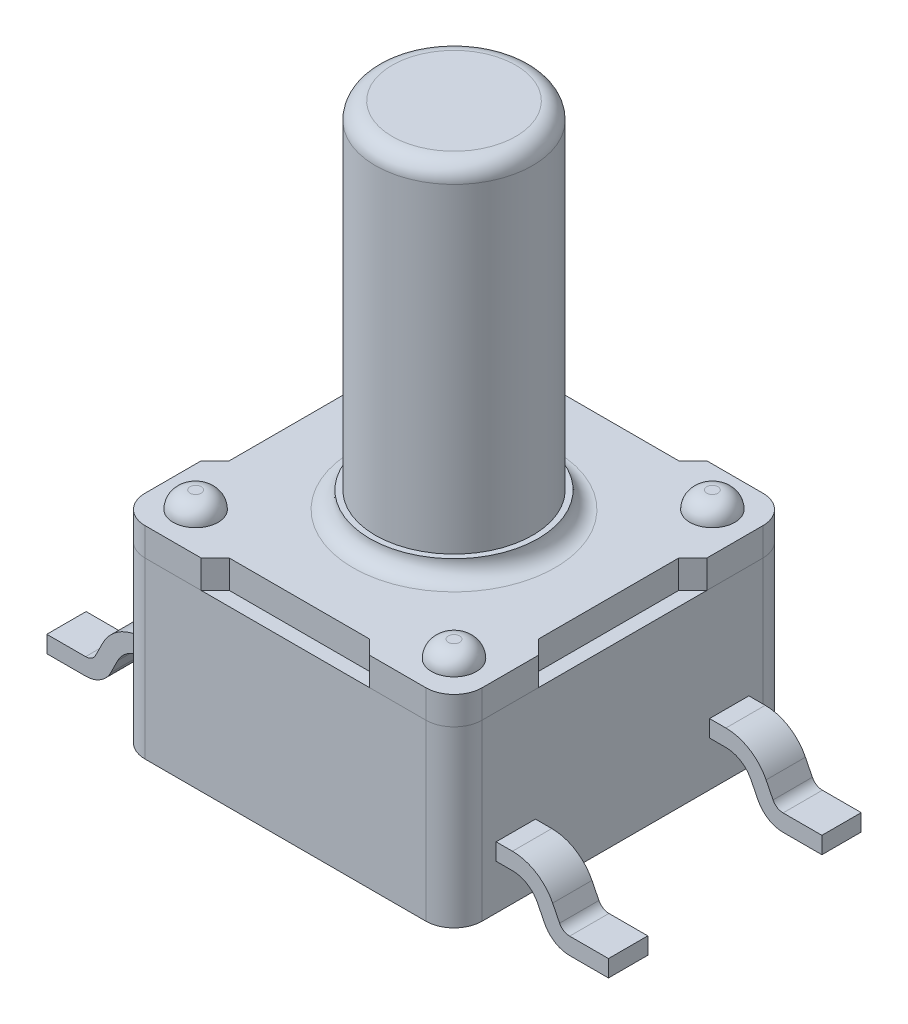
from build123d import *

# Parameters (mm, degrees)
BOSS_EXTRUDE1_DEPTH   = 3.1
BOSS_EXTRUDE2_DEPTH   = 0.5
SKETCH3_R             = 0.4
BOSS_EXTRUDE3_DEPTH   = 0.3
BOSS_EXTRUDE3_2_DEPTH = 0.3
BOSS_EXTRUDE3_3_DEPTH = 0.3
BOSS_EXTRUDE3_4_DEPTH = 0.3
FILLET1_R             = 0.3
FILLET2_R             = 0.3
FILLET3_R             = 0.3
FILLET4_R             = 0.3
SKETCH4_R             = 1.5
BOSS_EXTRUDE4_DEPTH   = 0.3
BOSS_EXTRUDE6_START   = 2.25
BOSS_EXTRUDE6_DEPTH   = 0.7
LPATTERN1_COUNT       = 2
LPATTERN1_PITCH       = 3.8
MIRROR5_START         = 2.25
MIRROR5_COPY_1_DEPTH  = 0.7
CUT_EXTRUDE1_DEPTH    = 0.5
FILLET8_R             = 0.3
SKETCH10_R            = 1.4
BOSS_EXTRUDE10_DEPTH  = 6
FILLET9_R             = 0.3


# Some blends are built 0.0001 mm under size
with BuildPart() as part:
    # Sketch1 → Boss-Extrude1 (new body)
    with BuildSketch(Plane(origin=(0, 0, 0), x_dir=(1, 0, 0), z_dir=(0, 1, 0))):
        with BuildLine():
            Line((-2.5, -3), (2.5, -3))
            ThreePointArc((2.5, -3), (2.853553391, -2.853553391), (3, -2.5))
            Line((3, -2.5), (3, 2.5))
            ThreePointArc((3, 2.5), (2.853553391, 2.853553391), (2.5, 3))
            Line((2.5, 3), (-2.5, 3))
            ThreePointArc((-2.5, 3), (-2.853553391, 2.853553391), (-3, 2.5))
            Line((-3, 2.5), (-3, -2.5))
            ThreePointArc((-3, -2.5), (-2.853553391, -2.853553391), (-2.5, -3))
        make_face()
    extrude(amount=BOSS_EXTRUDE1_DEPTH)


with BuildPart() as body_2:
    # Sketch2 → Boss-Extrude2 (new body)
    with BuildSketch(Plane(origin=(0, 3.1, 0), x_dir=(1, 0, 0), z_dir=(0, 1, 0))):
        with BuildLine():
            Line((-2.5, -3), (2.5, -3))
            ThreePointArc((2.5, -3), (2.853553391, -2.853553391), (3, -2.5))
            Line((3, -2.5), (3, 2.5))
            ThreePointArc((3, 2.5), (2.853553391, 2.853553391), (2.5, 3))
            Line((2.5, 3), (-2.5, 3))
            ThreePointArc((-2.5, 3), (-2.853553391, 2.853553391), (-3, 2.5))
            Line((-3, 2.5), (-3, -2.5))
            ThreePointArc((-3, -2.5), (-2.853553391, -2.853553391), (-2.5, -3))
        make_face()
    extrude(amount=BOSS_EXTRUDE2_DEPTH)

    # Sketch4 → Boss-Extrude4 (add)
    with BuildSketch(Plane(origin=(0, 3.6, 0), x_dir=(1, 0, 0), z_dir=(0, 1, 0))):
        with Locations(Location((0, 0, 0), (0, 0, 270))):
            Circle(SKETCH4_R)
    extrude(amount=BOSS_EXTRUDE4_DEPTH)

    # Sketch7 → Cut-Extrude1 (cut)
    with BuildSketch(Plane(origin=(0, 3.6, 0), x_dir=(1, 0, 0), z_dir=(0, 1, 0))):
        Polygon((-1.5, 3), (-1.25, 2.75), (1.25, 2.75), (1.5, 3), align=None)
        Polygon((3, -1.5), (3, 1.5), (2.75, 1.25), (2.75, -1.25), align=None)
        Polygon((-1.5, -3), (1.5, -3), (1.25, -2.75), (-1.25, -2.75), align=None)
        Polygon((-3, 1.5), (-3, -1.5), (-2.75, -1.25), (-2.75, 1.25), align=None)
    extrude(amount=-CUT_EXTRUDE1_DEPTH, mode=Mode.SUBTRACT)

    # Fillet8
    fillet8_edges = [body_2.edges().sort_by_distance(p)[0] for p in [
        (0, 3.6, -1.5),
    ]]
    fillet(fillet8_edges, radius=FILLET8_R - 0.0001)  # a hair under: the kernel refuses the full size


with BuildPart() as body_3:
    # Sketch3 → Boss-Extrude3 (new body)
    with BuildSketch(Plane(origin=(0, 3.6, 0), x_dir=(1, 0, 0), z_dir=(0, 1, 0))):
        with Locations(Location((-2.3, 2.3, 0), (0, 0, 270))):
            Circle(SKETCH3_R)
    extrude(amount=BOSS_EXTRUDE3_DEPTH)

    # Fillet2
    # the kernel refuses this fillet: 0.3 mm, written as the material it takes off along each edge
    with BuildSketch(Plane(origin=(-2.3, 3.9, -2.3), x_dir=(0, 0, 1), z_dir=(-1, 0, 0))) as fillet2_piece_1:
        with BuildLine():
            CenterArc((0.4 - FILLET2_R, -FILLET2_R), FILLET2_R, 0, 90)
            Line((0.4 - FILLET2_R, 0), (0.4, 0))
            Line((0.4, 0), (0.4, -FILLET2_R))
        make_face()
    revolve(axis=Axis((-2.3, 3.9, -2.3), (0, 1, 0)), mode=Mode.SUBTRACT)


with BuildPart() as body_4:
    # Sketch3 → Boss-Extrude3 2 (new body)
    with BuildSketch(Plane(origin=(0, 3.6, 0), x_dir=(1, 0, 0), z_dir=(0, 1, 0))):
        with Locations(Location((2.3, 2.3, 0), (0, 0, 270))):
            Circle(SKETCH3_R)
    extrude(amount=BOSS_EXTRUDE3_2_DEPTH)

    # Fillet3
    # the kernel refuses this fillet: 0.3 mm, written as the material it takes off along each edge
    with BuildSketch(Plane(origin=(2.3, 3.9, -2.3), x_dir=(0, 0, 1), z_dir=(-1, 0, 0))) as fillet3_piece_1:
        with BuildLine():
            CenterArc((0.4 - FILLET3_R, -FILLET3_R), FILLET3_R, 0, 90)
            Line((0.4 - FILLET3_R, 0), (0.4, 0))
            Line((0.4, 0), (0.4, -FILLET3_R))
        make_face()
    revolve(axis=Axis((2.3, 3.9, -2.3), (0, 1, 0)), mode=Mode.SUBTRACT)


with BuildPart() as body_5:
    # Sketch3 → Boss-Extrude3 3 (new body)
    with BuildSketch(Plane(origin=(0, 3.6, 0), x_dir=(1, 0, 0), z_dir=(0, 1, 0))):
        with Locations(Location((2.3, -2.3, 0), (0, 0, 270))):
            Circle(SKETCH3_R)
    extrude(amount=BOSS_EXTRUDE3_3_DEPTH)

    # Fillet4
    # the kernel refuses this fillet: 0.3 mm, written as the material it takes off along each edge
    with BuildSketch(Plane(origin=(2.3, 3.9, 2.3), x_dir=(0, 0, 1), z_dir=(-1, 0, 0))) as fillet4_piece_1:
        with BuildLine():
            CenterArc((0.4 - FILLET4_R, -FILLET4_R), FILLET4_R, 0, 90)
            Line((0.4 - FILLET4_R, 0), (0.4, 0))
            Line((0.4, 0), (0.4, -FILLET4_R))
        make_face()
    revolve(axis=Axis((2.3, 3.9, 2.3), (0, 1, 0)), mode=Mode.SUBTRACT)


with BuildPart() as body_6:
    # Sketch3 → Boss-Extrude3 4 (new body)
    with BuildSketch(Plane(origin=(0, 3.6, 0), x_dir=(1, 0, 0), z_dir=(0, 1, 0))):
        with Locations(Location((-2.3, -2.3, 0), (0, 0, 270))):
            Circle(SKETCH3_R)
    extrude(amount=BOSS_EXTRUDE3_4_DEPTH)

    # Fillet1
    # the kernel refuses this fillet: 0.3 mm, written as the material it takes off along each edge
    with BuildSketch(Plane(origin=(-2.3, 3.9, 2.3), x_dir=(0, 0, 1), z_dir=(-1, 0, 0))) as fillet1_piece_1:
        with BuildLine():
            CenterArc((0.4 - FILLET1_R, -FILLET1_R), FILLET1_R, 0, 90)
            Line((0.4 - FILLET1_R, 0), (0.4, 0))
            Line((0.4, 0), (0.4, -FILLET1_R))
        make_face()
    revolve(axis=Axis((-2.3, 3.9, 2.3), (0, 1, 0)), mode=Mode.SUBTRACT)


with BuildPart() as body_7:
    # Sketch6 → Boss-Extrude6 (new body)
    with BuildSketch(Plane.XY.offset(BOSS_EXTRUDE6_START)):
        with BuildLine():
            Line((3, 0.8), (3.290983006, 0.8))
            ThreePointArc((3.290983006, 0.8), (3.553848562, 0.725325404), (3.738196601, 0.523606798))
            Line((3.738196601, 0.523606798), (3.861803399, 0.276393202))
            ThreePointArc((3.861803399, 0.276393202), (4.046151438, 0.074674596), (4.309016994, 0))
            Line((4.309016994, 0), (5, 0))
            Line((5, 0), (5, 0.3))
            Line((5, 0.3), (4.309016994, 0.3))
            ThreePointArc((4.309016994, 0.3), (4.203870772, 0.329869838), (4.130131556, 0.410557281))
            Line((4.130131556, 0.410557281), (4.006524758, 0.657770876))
            ThreePointArc((4.006524758, 0.657770876), (3.711567895, 0.980520647), (3.290983006, 1.1))
            Line((3.290983006, 1.1), (3, 1.1))
            Line((3, 1.1), (3, 0.8))
        make_face()
    boss_extrude6 = extrude(amount=-BOSS_EXTRUDE6_DEPTH)


with BuildPart() as lpattern1_1:
    # LPattern1: Boss-Extrude6 ×2
    with Locations(*[(0, 0, -i * LPATTERN1_PITCH) for i in range(1, LPATTERN1_COUNT)]):
        add(boss_extrude6)


with BuildPart() as part_1:
    add(part.part)

    # Mirror5: Boss-Extrude6 across plane
    add(boss_extrude6.mirror(Plane(origin=(0, 0, 0), x_dir=(0, 0, 1), z_dir=(1, 0, 0))))

    # Mirror5 copy 1 sketch → Mirror5 copy 1 (add)
    with BuildSketch(Plane(origin=(0, 0, -3.8), x_dir=(-1, 0, 0), z_dir=(0, 0, 1)).offset(MIRROR5_START)):
        with BuildLine():
            Line((3, -0.8), (3.290983006, -0.8))
            ThreePointArc((3.290983006, -0.8), (3.553848562, -0.725325404), (3.738196601, -0.523606798))
            Line((3.738196601, -0.523606798), (3.861803399, -0.276393202))
            ThreePointArc((3.861803399, -0.276393202), (4.046151438, -0.074674596), (4.309016994, 0))
            Line((4.309016994, 0), (5, 0))
            Line((5, 0), (5, -0.3))
            Line((5, -0.3), (4.309016994, -0.3))
            ThreePointArc((4.309016994, -0.3), (4.203870772, -0.329869838), (4.130131556, -0.410557281))
            Line((4.130131556, -0.410557281), (4.006524758, -0.657770876))
            ThreePointArc((4.006524758, -0.657770876), (3.711567895, -0.980520647), (3.290983006, -1.1))
            Line((3.290983006, -1.1), (3, -1.1))
            Line((3, -1.1), (3, -0.8))
        make_face()
    extrude(amount=-MIRROR5_COPY_1_DEPTH)


with BuildPart() as body_9:
    # Sketch10 → Boss-Extrude10 (new body)
    with BuildSketch(Plane(origin=(0, 3.9, 0), x_dir=(1, 0, 0), z_dir=(0, 1, 0))):
        with Locations(Location((0, 0, 0), (0, 0, 270))):
            Circle(SKETCH10_R)
    extrude(amount=BOSS_EXTRUDE10_DEPTH)

    # Fillet9
    fillet9_edges = [body_9.edges().sort_by_distance(p)[0] for p in [
        (0, 9.9, -1.4),
    ]]
    fillet(fillet9_edges, radius=FILLET9_R)


solid = Compound([body_2.part, body_3.part, body_4.part, body_5.part, body_6.part, body_7.part, lpattern1_1.part, part_1.part, body_9.part])
